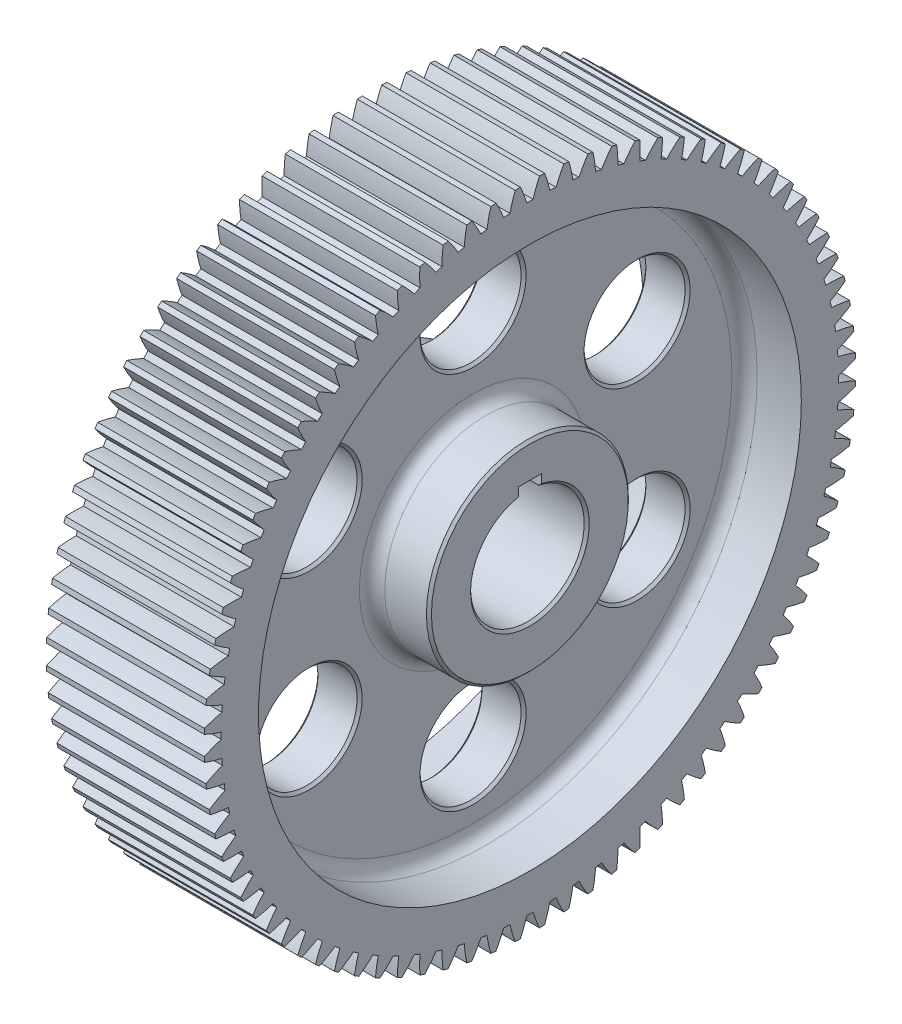
from build123d import *

# Parameters (mm, degrees)
BASPROSKE_W        = 125
BASPROSKE_H        = 257.999999999
TOOTHCUT_DEPTH     = 386.685104716
TEETHCUTS_COUNT    = 84
BORSKE_R           = 45
BORE_DEPTH         = 125
SKETCH1_R          = 215
SKETCH1_R_2        = 80
CUT_EXTRUDE1_DEPTH = 45
CUT_EXTRUDE2_START = -80
SKETCH1_2_R        = 215
SKETCH1_2_R_2      = 80
CUT_EXTRUDE2_DEPTH = 45
FILLET1_R          = 10
SKETCH2_R          = 40
SKETCH2_W          = 18
SKETCH2_H          = 16
CUT_EXTRUDE3_DEPTH = 386.534314407
CHAMFER1_SIZE      = 2


with BuildPart() as part:
    # BasProSke → Base-Revolve (revolve)
    with BuildSketch(Plane(origin=(0, 0, 0), x_dir=(1, 0, 0), z_dir=(0, 1, 0)), mode=Mode.PRIVATE) as base_revolve_sk:
        with Locations((62.5, 129)):
            Rectangle(BASPROSKE_W, BASPROSKE_H)
    revolve(base_revolve_sk.sketch.rotate(Axis((-10, 0, 0), (1, 0, 0)), 180), axis=Axis((-10, 0, 0), (1, 0, 0)))

    # TooCutSke → ToothCut (cut, through all)
    with BuildSketch(Plane(origin=(0, 0, 0), x_dir=(0, 0, -1), z_dir=(1, 0, 0))):
        with BuildLine():
            ThreePointArc((2.48084672, 244.486413529), (0, 244.499), (-2.48084672, 244.486413529))
            ThreePointArc((-2.48084672, 244.486413529), (-4.819219553, 251.291461553), (-7.637102755, 257.91235276))
            ThreePointArc((-7.637102755, 257.91235276), (0, 258.025399999), (7.637102755, 257.91235276))
            ThreePointArc((7.637102755, 257.91235276), (4.819219553, 251.291461553), (2.48084672, 244.486413529))
        make_face()
    toothcut = extrude(amount=TOOTHCUT_DEPTH, mode=Mode.SUBTRACT)

    # TeethCuts: ToothCut ×84 about axis
    teethcuts_axis = Axis((0, 0, 0), (1, 0, 0))
    for i in range(1, TEETHCUTS_COUNT):
        add(toothcut.rotate(teethcuts_axis, i * 360 / TEETHCUTS_COUNT), mode=Mode.SUBTRACT)

    # BorSke → Bore (cut, symmetric)
    with BuildSketch(Plane(origin=(0, 0, 0), x_dir=(0, 0, -1), z_dir=(1, 0, 0))):
        with Locations(Location((0, 0, 0), (0, 0, 180))):
            Circle(BORSKE_R)
    extrude(amount=BORE_DEPTH, both=True, mode=Mode.SUBTRACT)

    # Sketch1 → Cut-Extrude1 (cut)
    with BuildSketch(Plane(origin=(125, 0, 0), x_dir=(0, 0, -1), z_dir=(1, 0, 0))):
        Circle(SKETCH1_R)
        Circle(SKETCH1_R_2, mode=Mode.SUBTRACT)
    extrude(amount=-CUT_EXTRUDE1_DEPTH, mode=Mode.SUBTRACT)

    # Sketch1<2> → Cut-Extrude2 (cut)
    with BuildSketch(Plane(origin=(125, 0, 0), x_dir=(0, 0, -1), z_dir=(1, 0, 0)).offset(CUT_EXTRUDE2_START)):
        Circle(SKETCH1_2_R)
        Circle(SKETCH1_2_R_2, mode=Mode.SUBTRACT)
    extrude(amount=-CUT_EXTRUDE2_DEPTH, mode=Mode.SUBTRACT)

    # Fillet1
    fillet1_edges = [part.edges().sort_by_distance(p)[0] for p in [
        (80, 0, 215),
        (80, 0, 80),
        (45, 0, 215),
        (45, 0, 80),
    ]]
    fillet(fillet1_edges, radius=FILLET1_R)

    # Sketch2 → Cut-Extrude3 (cut, through all)
    with BuildSketch(Plane(origin=(125, 0, 0), x_dir=(0, 0, -1), z_dir=(1, 0, 0))):
        with Locations((0, 150)):
            Circle(SKETCH2_R)
        with Locations((129.903810568, 75)):
            Circle(SKETCH2_R)
        with Locations((129.903810568, -75)):
            Circle(SKETCH2_R)
        with Locations((0, -150)):
            Circle(SKETCH2_R)
        with Locations((-129.903810568, -75)):
            Circle(SKETCH2_R)
        with Locations((-129.903810568, 75)):
            Circle(SKETCH2_R)
        with Locations((0, 45)):
            Rectangle(SKETCH2_W, SKETCH2_H)
    extrude(amount=-CUT_EXTRUDE3_DEPTH, mode=Mode.SUBTRACT)

    # Chamfer1
    chamfer1_edges = [part.edges().sort_by_distance(p)[0] for p in [
        (125, 0, 80),
        (0, 0, 80),
        (0, -45, 0),
        (125, -45, 0),
        (80, 75, 169.903810568),
        (45, 75, 169.903810568),
        (80, -75, 169.903810568),
        (45, -75, 169.903810568),
        (80, -150, 40),
        (45, -150, 40),
        (80, -75, -89.903810568),
        (45, -75, -89.903810568),
        (80, 75, -89.903810568),
        (45, 75, -89.903810568),
        (80, 150, 40),
        (45, 150, 40),
    ]]
    chamfer(chamfer1_edges, length=CHAMFER1_SIZE)


solid = part.part
